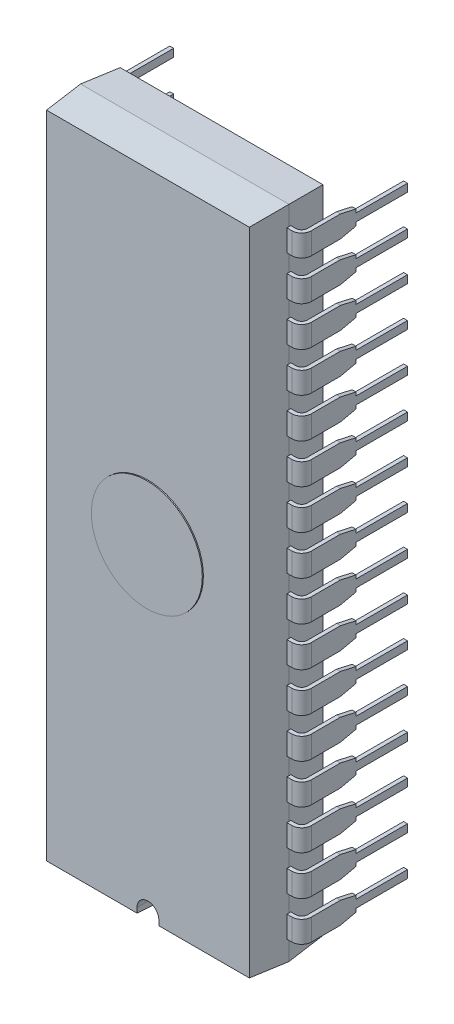
from build123d import *

# Parameters (mm, degrees)
BASIC_SHAPE_DEPTH               = 21.02
SIDE_PROFILE1_DEPTH             = 23.785548051
SIDE_PROFILE1_DEPTH_BACK        = 23.785548051
SIDE_PROFILE2_DEPTH             = 23.785548051
SIDE_PROFILE2_DEPTH_BACK        = 23.785548051
SKETCH6_W                       = 0.25
SKETCH6_H                       = 1.39
PIN_RELIEF_DEPTH                = 26.921132383
REMAINING_PINS_COUNT            = 16
REMAINING_PINS_PITCH            = 2.54
REMAINING_PINS_COPY_1_SKETCH_W  = 0.25
REMAINING_PINS_COPY_1_SKETCH_H  = 1.39
REMAINING_PINS_COPY_2_SKETCH_W  = 0.25
REMAINING_PINS_COPY_2_SKETCH_H  = 1.39
REMAINING_PINS_COPY_3_SKETCH_W  = 0.25
REMAINING_PINS_COPY_3_SKETCH_H  = 1.39
REMAINING_PINS_COPY_4_SKETCH_W  = 0.25
REMAINING_PINS_COPY_4_SKETCH_H  = 1.39
REMAINING_PINS_COPY_5_SKETCH_W  = 0.25
REMAINING_PINS_COPY_5_SKETCH_H  = 1.39
REMAINING_PINS_COPY_6_SKETCH_W  = 0.25
REMAINING_PINS_COPY_6_SKETCH_H  = 1.39
REMAINING_PINS_COPY_7_SKETCH_W  = 0.25
REMAINING_PINS_COPY_7_SKETCH_H  = 1.39
REMAINING_PINS_COPY_8_SKETCH_W  = 0.25
REMAINING_PINS_COPY_8_SKETCH_H  = 1.39
REMAINING_PINS_COPY_9_SKETCH_W  = 0.25
REMAINING_PINS_COPY_9_SKETCH_H  = 1.39
REMAINING_PINS_COPY_10_SKETCH_W = 0.25
REMAINING_PINS_COPY_10_SKETCH_H = 1.39
REMAINING_PINS_COPY_11_SKETCH_W = 0.25
REMAINING_PINS_COPY_11_SKETCH_H = 1.39
REMAINING_PINS_COPY_12_SKETCH_W = 0.25
REMAINING_PINS_COPY_12_SKETCH_H = 1.39
REMAINING_PINS_COPY_13_SKETCH_W = 0.25
REMAINING_PINS_COPY_13_SKETCH_H = 1.39
REMAINING_PINS_COPY_14_SKETCH_W = 0.25
REMAINING_PINS_COPY_14_SKETCH_H = 1.39
REMAINING_PINS_COPY_15_SKETCH_W = 0.25
REMAINING_PINS_COPY_15_SKETCH_H = 1.39
REMAINING_PINS_COPY_16_DEPTH    = 26.921132383
REMAINING_PINS_COPY_17_DEPTH    = 26.921132383
REMAINING_PINS_COPY_18_DEPTH    = 26.921132383
REMAINING_PINS_COPY_19_DEPTH    = 26.921132383
REMAINING_PINS_COPY_20_DEPTH    = 26.921132383
REMAINING_PINS_COPY_21_DEPTH    = 26.921132383
REMAINING_PINS_COPY_22_DEPTH    = 26.921132383
REMAINING_PINS_COPY_23_DEPTH    = 26.921132383
REMAINING_PINS_COPY_24_DEPTH    = 26.921132383
REMAINING_PINS_COPY_25_DEPTH    = 26.921132383
REMAINING_PINS_COPY_26_DEPTH    = 26.921132383
REMAINING_PINS_COPY_27_DEPTH    = 26.921132383
REMAINING_PINS_COPY_28_DEPTH    = 26.921132383
REMAINING_PINS_COPY_29_DEPTH    = 26.921132383
REMAINING_PINS_COPY_30_DEPTH    = 26.921132383
WINDOW_START                    = 5.72
WINDOW_OUTLINE_R                = 3.556
WINDOW_DEPTH                    = 0.07
LOCATION_MARK_DEPTH             = 25.108810091


# Read off the part's stored shape, not the designer's step: Window
with BuildPart() as part:
    # Sketch1 → Basic Shape (new, symmetric)
    with BuildSketch(Plane(origin=(0, 0, 0), x_dir=(1, 0, 0), z_dir=(0, 1, 0))):
        Polygon((-6.5, -5.72), (-6.68, -3.36), (-6.5, -1), (6.5, -1), (6.68, -3.36), (6.5, -5.72), align=None)
    extrude(amount=BASIC_SHAPE_DEPTH, both=True)

    # Sketch2 → Side Profile1 (cut, two sides: drawn at the far end of the back side and taken through both)
    with BuildSketch(Plane(origin=(0, 0, 0), x_dir=(0, 0, -1), z_dir=(1, 0, 0)).offset(-SIDE_PROFILE1_DEPTH_BACK)):
        Polygon((-1, 21.02), (-1, 20.84), (-3.36, 21.02), align=None)
        Polygon((-1, -21.02), (-3.36, -21.02), (-1, -20.84), align=None)
    extrude(amount=SIDE_PROFILE1_DEPTH + SIDE_PROFILE1_DEPTH_BACK, mode=Mode.SUBTRACT)

    # Sketch3 → Side Profile2 (cut, two sides: drawn at the far end of the back side and taken through both)
    with BuildSketch(Plane(origin=(0, 0, 0), x_dir=(0, 0, -1), z_dir=(1, 0, 0)).offset(-SIDE_PROFILE2_DEPTH_BACK)):
        Polygon((-3.36, 21.02), (-5.72, 21.02), (-5.72, 20.84), align=None)
        Polygon((-3.36, -21.02), (-5.72, -21.02), (-5.72, -20.84), align=None)
    extrude(amount=SIDE_PROFILE2_DEPTH + SIDE_PROFILE2_DEPTH_BACK, mode=Mode.SUBTRACT)

    # First Pin: sweep along a path in Sketch5
    with BuildLine(Plane(origin=(0, -19.02, 0), x_dir=(1, 0, 0), z_dir=(0, 1, 0))) as first_pin_path:
        Line((0, -3.36), (6.993, -3.36))
        ThreePointArc((6.993, -3.36), (7.346553391, -3.213553391), (7.493, -2.86))
        Line((7.493, -2.86), (7.493, 3.3))
    # Sketch6 → First Pin (sweep)
    with BuildSketch(Plane(origin=(0, 0, 0), x_dir=(0, 0, -1), z_dir=(1, 0, 0))):
        with Locations((-3.36, -19.02)):
            Rectangle(SKETCH6_W, SKETCH6_H)
    first_pin = sweep(path=first_pin_path.line)

    # Sketch7 → Pin Relief (cut, through all)
    with BuildSketch(Plane.ZY.offset(-7.368)):
        Polygon((-3.3, -19.27), (0, -19.27), (0, -19.4925), (1, -19.715), (-3.3, -19.715), align=None)
        Polygon((-3.3, -18.77), (0, -18.77), (0, -18.5475), (1, -18.325), (-3.3, -18.325), align=None)
    pin_relief = extrude(amount=-PIN_RELIEF_DEPTH, mode=Mode.SUBTRACT)

    # Opp Pin: First Pin, Pin Relief across plane
    add(first_pin.mirror(Plane(origin=(0, 0, 0), x_dir=(0, 0, 1), z_dir=(1, 0, 0))))
    add(pin_relief.mirror(Plane(origin=(0, 0, 0), x_dir=(0, 0, 1), z_dir=(1, 0, 0))), mode=Mode.SUBTRACT)

    # Remaining Pins: First Pin, Pin Relief ×16
    with Locations(*[(0, i * REMAINING_PINS_PITCH, 0) for i in range(1, REMAINING_PINS_COUNT)]):
        add(first_pin)
        add(pin_relief, mode=Mode.SUBTRACT)

    # Remaining Pins copy 1: sweep along a path in Remaining Pins copy 1 path
    with BuildLine(Plane(origin=(0, -16.48, 0), x_dir=(-1, 0, 0), z_dir=(0, 1, 0))) as remaining_pins_copy_1_path:
        Line((0, 3.36), (6.993, 3.36))
        ThreePointArc((6.993, 3.36), (7.346553391, 3.213553391), (7.493, 2.86))
        Line((7.493, 2.86), (7.493, -3.3))
    # Remaining Pins copy 1 sketch → Remaining Pins copy 1 (sweep)
    with BuildSketch(Plane(origin=(0, 2.54, 0), x_dir=(0, 0, -1), z_dir=(-1, 0, 0))):
        with Locations((-3.36, 19.02)):
            Rectangle(REMAINING_PINS_COPY_1_SKETCH_W, REMAINING_PINS_COPY_1_SKETCH_H)
    sweep(path=remaining_pins_copy_1_path.line)

    # Remaining Pins copy 2: sweep along a path in Remaining Pins copy 2 path
    with BuildLine(Plane(origin=(0, -13.94, 0), x_dir=(-1, 0, 0), z_dir=(0, 1, 0))) as remaining_pins_copy_2_path:
        Line((0, 3.36), (6.993, 3.36))
        ThreePointArc((6.993, 3.36), (7.346553391, 3.213553391), (7.493, 2.86))
        Line((7.493, 2.86), (7.493, -3.3))
    # Remaining Pins copy 2 sketch → Remaining Pins copy 2 (sweep)
    with BuildSketch(Plane(origin=(0, 5.08, 0), x_dir=(0, 0, -1), z_dir=(-1, 0, 0))):
        with Locations((-3.36, 19.02)):
            Rectangle(REMAINING_PINS_COPY_2_SKETCH_W, REMAINING_PINS_COPY_2_SKETCH_H)
    sweep(path=remaining_pins_copy_2_path.line)

    # Remaining Pins copy 3: sweep along a path in Remaining Pins copy 3 path
    with BuildLine(Plane(origin=(0, -11.4, 0), x_dir=(-1, 0, 0), z_dir=(0, 1, 0))) as remaining_pins_copy_3_path:
        Line((0, 3.36), (6.993, 3.36))
        ThreePointArc((6.993, 3.36), (7.346553391, 3.213553391), (7.493, 2.86))
        Line((7.493, 2.86), (7.493, -3.3))
    # Remaining Pins copy 3 sketch → Remaining Pins copy 3 (sweep)
    with BuildSketch(Plane(origin=(0, 7.62, 0), x_dir=(0, 0, -1), z_dir=(-1, 0, 0))):
        with Locations((-3.36, 19.02)):
            Rectangle(REMAINING_PINS_COPY_3_SKETCH_W, REMAINING_PINS_COPY_3_SKETCH_H)
    sweep(path=remaining_pins_copy_3_path.line)

    # Remaining Pins copy 4: sweep along a path in Remaining Pins copy 4 path
    with BuildLine(Plane(origin=(0, -8.86, 0), x_dir=(-1, 0, 0), z_dir=(0, 1, 0))) as remaining_pins_copy_4_path:
        Line((0, 3.36), (6.993, 3.36))
        ThreePointArc((6.993, 3.36), (7.346553391, 3.213553391), (7.493, 2.86))
        Line((7.493, 2.86), (7.493, -3.3))
    # Remaining Pins copy 4 sketch → Remaining Pins copy 4 (sweep)
    with BuildSketch(Plane(origin=(0, 10.16, 0), x_dir=(0, 0, -1), z_dir=(-1, 0, 0))):
        with Locations((-3.36, 19.02)):
            Rectangle(REMAINING_PINS_COPY_4_SKETCH_W, REMAINING_PINS_COPY_4_SKETCH_H)
    sweep(path=remaining_pins_copy_4_path.line)

    # Remaining Pins copy 5: sweep along a path in Remaining Pins copy 5 path
    with BuildLine(Plane(origin=(0, -6.32, 0), x_dir=(-1, 0, 0), z_dir=(0, 1, 0))) as remaining_pins_copy_5_path:
        Line((0, 3.36), (6.993, 3.36))
        ThreePointArc((6.993, 3.36), (7.346553391, 3.213553391), (7.493, 2.86))
        Line((7.493, 2.86), (7.493, -3.3))
    # Remaining Pins copy 5 sketch → Remaining Pins copy 5 (sweep)
    with BuildSketch(Plane(origin=(0, 12.7, 0), x_dir=(0, 0, -1), z_dir=(-1, 0, 0))):
        with Locations((-3.36, 19.02)):
            Rectangle(REMAINING_PINS_COPY_5_SKETCH_W, REMAINING_PINS_COPY_5_SKETCH_H)
    sweep(path=remaining_pins_copy_5_path.line)

    # Remaining Pins copy 6: sweep along a path in Remaining Pins copy 6 path
    with BuildLine(Plane(origin=(0, -3.78, 0), x_dir=(-1, 0, 0), z_dir=(0, 1, 0))) as remaining_pins_copy_6_path:
        Line((0, 3.36), (6.993, 3.36))
        ThreePointArc((6.993, 3.36), (7.346553391, 3.213553391), (7.493, 2.86))
        Line((7.493, 2.86), (7.493, -3.3))
    # Remaining Pins copy 6 sketch → Remaining Pins copy 6 (sweep)
    with BuildSketch(Plane(origin=(0, 15.24, 0), x_dir=(0, 0, -1), z_dir=(-1, 0, 0))):
        with Locations((-3.36, 19.02)):
            Rectangle(REMAINING_PINS_COPY_6_SKETCH_W, REMAINING_PINS_COPY_6_SKETCH_H)
    sweep(path=remaining_pins_copy_6_path.line)

    # Remaining Pins copy 7: sweep along a path in Remaining Pins copy 7 path
    with BuildLine(Plane(origin=(0, -1.24, 0), x_dir=(-1, 0, 0), z_dir=(0, 1, 0))) as remaining_pins_copy_7_path:
        Line((0, 3.36), (6.993, 3.36))
        ThreePointArc((6.993, 3.36), (7.346553391, 3.213553391), (7.493, 2.86))
        Line((7.493, 2.86), (7.493, -3.3))
    # Remaining Pins copy 7 sketch → Remaining Pins copy 7 (sweep)
    with BuildSketch(Plane(origin=(0, 17.78, 0), x_dir=(0, 0, -1), z_dir=(-1, 0, 0))):
        with Locations((-3.36, 19.02)):
            Rectangle(REMAINING_PINS_COPY_7_SKETCH_W, REMAINING_PINS_COPY_7_SKETCH_H)
    sweep(path=remaining_pins_copy_7_path.line)

    # Remaining Pins copy 8: sweep along a path in Remaining Pins copy 8 path
    with BuildLine(Plane(origin=(0, 1.3, 0), x_dir=(-1, 0, 0), z_dir=(0, 1, 0))) as remaining_pins_copy_8_path:
        Line((0, 3.36), (6.993, 3.36))
        ThreePointArc((6.993, 3.36), (7.346553391, 3.213553391), (7.493, 2.86))
        Line((7.493, 2.86), (7.493, -3.3))
    # Remaining Pins copy 8 sketch → Remaining Pins copy 8 (sweep)
    with BuildSketch(Plane(origin=(0, 20.32, 0), x_dir=(0, 0, -1), z_dir=(-1, 0, 0))):
        with Locations((-3.36, 19.02)):
            Rectangle(REMAINING_PINS_COPY_8_SKETCH_W, REMAINING_PINS_COPY_8_SKETCH_H)
    sweep(path=remaining_pins_copy_8_path.line)

    # Remaining Pins copy 9: sweep along a path in Remaining Pins copy 9 path
    with BuildLine(Plane(origin=(0, 3.84, 0), x_dir=(-1, 0, 0), z_dir=(0, 1, 0))) as remaining_pins_copy_9_path:
        Line((0, 3.36), (6.993, 3.36))
        ThreePointArc((6.993, 3.36), (7.346553391, 3.213553391), (7.493, 2.86))
        Line((7.493, 2.86), (7.493, -3.3))
    # Remaining Pins copy 9 sketch → Remaining Pins copy 9 (sweep)
    with BuildSketch(Plane(origin=(0, 22.86, 0), x_dir=(0, 0, -1), z_dir=(-1, 0, 0))):
        with Locations((-3.36, 19.02)):
            Rectangle(REMAINING_PINS_COPY_9_SKETCH_W, REMAINING_PINS_COPY_9_SKETCH_H)
    sweep(path=remaining_pins_copy_9_path.line)

    # Remaining Pins copy 10: sweep along a path in Remaining Pins copy 10 path
    with BuildLine(Plane(origin=(0, 6.38, 0), x_dir=(-1, 0, 0), z_dir=(0, 1, 0))) as remaining_pins_copy_10_path:
        Line((0, 3.36), (6.993, 3.36))
        ThreePointArc((6.993, 3.36), (7.346553391, 3.213553391), (7.493, 2.86))
        Line((7.493, 2.86), (7.493, -3.3))
    # Remaining Pins copy 10 sketch → Remaining Pins copy 10 (sweep)
    with BuildSketch(Plane(origin=(0, 25.4, 0), x_dir=(0, 0, -1), z_dir=(-1, 0, 0))):
        with Locations((-3.36, 19.02)):
            Rectangle(REMAINING_PINS_COPY_10_SKETCH_W, REMAINING_PINS_COPY_10_SKETCH_H)
    sweep(path=remaining_pins_copy_10_path.line)

    # Remaining Pins copy 11: sweep along a path in Remaining Pins copy 11 path
    with BuildLine(Plane(origin=(0, 8.92, 0), x_dir=(-1, 0, 0), z_dir=(0, 1, 0))) as remaining_pins_copy_11_path:
        Line((0, 3.36), (6.993, 3.36))
        ThreePointArc((6.993, 3.36), (7.346553391, 3.213553391), (7.493, 2.86))
        Line((7.493, 2.86), (7.493, -3.3))
    # Remaining Pins copy 11 sketch → Remaining Pins copy 11 (sweep)
    with BuildSketch(Plane(origin=(0, 27.94, 0), x_dir=(0, 0, -1), z_dir=(-1, 0, 0))):
        with Locations((-3.36, 19.02)):
            Rectangle(REMAINING_PINS_COPY_11_SKETCH_W, REMAINING_PINS_COPY_11_SKETCH_H)
    sweep(path=remaining_pins_copy_11_path.line)

    # Remaining Pins copy 12: sweep along a path in Remaining Pins copy 12 path
    with BuildLine(Plane(origin=(0, 11.46, 0), x_dir=(-1, 0, 0), z_dir=(0, 1, 0))) as remaining_pins_copy_12_path:
        Line((0, 3.36), (6.993, 3.36))
        ThreePointArc((6.993, 3.36), (7.346553391, 3.213553391), (7.493, 2.86))
        Line((7.493, 2.86), (7.493, -3.3))
    # Remaining Pins copy 12 sketch → Remaining Pins copy 12 (sweep)
    with BuildSketch(Plane(origin=(0, 30.48, 0), x_dir=(0, 0, -1), z_dir=(-1, 0, 0))):
        with Locations((-3.36, 19.02)):
            Rectangle(REMAINING_PINS_COPY_12_SKETCH_W, REMAINING_PINS_COPY_12_SKETCH_H)
    sweep(path=remaining_pins_copy_12_path.line)

    # Remaining Pins copy 13: sweep along a path in Remaining Pins copy 13 path
    with BuildLine(Plane(origin=(0, 14, 0), x_dir=(-1, 0, 0), z_dir=(0, 1, 0))) as remaining_pins_copy_13_path:
        Line((0, 3.36), (6.993, 3.36))
        ThreePointArc((6.993, 3.36), (7.346553391, 3.213553391), (7.493, 2.86))
        Line((7.493, 2.86), (7.493, -3.3))
    # Remaining Pins copy 13 sketch → Remaining Pins copy 13 (sweep)
    with BuildSketch(Plane(origin=(0, 33.02, 0), x_dir=(0, 0, -1), z_dir=(-1, 0, 0))):
        with Locations((-3.36, 19.02)):
            Rectangle(REMAINING_PINS_COPY_13_SKETCH_W, REMAINING_PINS_COPY_13_SKETCH_H)
    sweep(path=remaining_pins_copy_13_path.line)

    # Remaining Pins copy 14: sweep along a path in Remaining Pins copy 14 path
    with BuildLine(Plane(origin=(0, 16.54, 0), x_dir=(-1, 0, 0), z_dir=(0, 1, 0))) as remaining_pins_copy_14_path:
        Line((0, 3.36), (6.993, 3.36))
        ThreePointArc((6.993, 3.36), (7.346553391, 3.213553391), (7.493, 2.86))
        Line((7.493, 2.86), (7.493, -3.3))
    # Remaining Pins copy 14 sketch → Remaining Pins copy 14 (sweep)
    with BuildSketch(Plane(origin=(0, 35.56, 0), x_dir=(0, 0, -1), z_dir=(-1, 0, 0))):
        with Locations((-3.36, 19.02)):
            Rectangle(REMAINING_PINS_COPY_14_SKETCH_W, REMAINING_PINS_COPY_14_SKETCH_H)
    sweep(path=remaining_pins_copy_14_path.line)

    # Remaining Pins copy 15: sweep along a path in Remaining Pins copy 15 path
    with BuildLine(Plane(origin=(0, 19.08, 0), x_dir=(-1, 0, 0), z_dir=(0, 1, 0))) as remaining_pins_copy_15_path:
        Line((0, 3.36), (6.993, 3.36))
        ThreePointArc((6.993, 3.36), (7.346553391, 3.213553391), (7.493, 2.86))
        Line((7.493, 2.86), (7.493, -3.3))
    # Remaining Pins copy 15 sketch → Remaining Pins copy 15 (sweep)
    with BuildSketch(Plane(origin=(0, 38.1, 0), x_dir=(0, 0, -1), z_dir=(-1, 0, 0))):
        with Locations((-3.36, 19.02)):
            Rectangle(REMAINING_PINS_COPY_15_SKETCH_W, REMAINING_PINS_COPY_15_SKETCH_H)
    sweep(path=remaining_pins_copy_15_path.line)

    # Remaining Pins copy 16 sketch → Remaining Pins copy 16 (cut, through all)
    with BuildSketch(Plane(origin=(-7.368, 2.54, 0), x_dir=(0, 0, 1), z_dir=(1, 0, 0))):
        Polygon((-3.3, 19.27), (0, 19.27), (0, 19.4925), (1, 19.715), (-3.3, 19.715), align=None)
        Polygon((-3.3, 18.77), (0, 18.77), (0, 18.5475), (1, 18.325), (-3.3, 18.325), align=None)
    extrude(amount=-REMAINING_PINS_COPY_16_DEPTH, mode=Mode.SUBTRACT)

    # Remaining Pins copy 17 sketch → Remaining Pins copy 17 (cut, through all)
    with BuildSketch(Plane(origin=(-7.368, 5.08, 0), x_dir=(0, 0, 1), z_dir=(1, 0, 0))):
        Polygon((-3.3, 19.27), (0, 19.27), (0, 19.4925), (1, 19.715), (-3.3, 19.715), align=None)
        Polygon((-3.3, 18.77), (0, 18.77), (0, 18.5475), (1, 18.325), (-3.3, 18.325), align=None)
    extrude(amount=-REMAINING_PINS_COPY_17_DEPTH, mode=Mode.SUBTRACT)

    # Remaining Pins copy 18 sketch → Remaining Pins copy 18 (cut, through all)
    with BuildSketch(Plane(origin=(-7.368, 7.62, 0), x_dir=(0, 0, 1), z_dir=(1, 0, 0))):
        Polygon((-3.3, 19.27), (0, 19.27), (0, 19.4925), (1, 19.715), (-3.3, 19.715), align=None)
        Polygon((-3.3, 18.77), (0, 18.77), (0, 18.5475), (1, 18.325), (-3.3, 18.325), align=None)
    extrude(amount=-REMAINING_PINS_COPY_18_DEPTH, mode=Mode.SUBTRACT)

    # Remaining Pins copy 19 sketch → Remaining Pins copy 19 (cut, through all)
    with BuildSketch(Plane(origin=(-7.368, 10.16, 0), x_dir=(0, 0, 1), z_dir=(1, 0, 0))):
        Polygon((-3.3, 19.27), (0, 19.27), (0, 19.4925), (1, 19.715), (-3.3, 19.715), align=None)
        Polygon((-3.3, 18.77), (0, 18.77), (0, 18.5475), (1, 18.325), (-3.3, 18.325), align=None)
    extrude(amount=-REMAINING_PINS_COPY_19_DEPTH, mode=Mode.SUBTRACT)

    # Remaining Pins copy 20 sketch → Remaining Pins copy 20 (cut, through all)
    with BuildSketch(Plane(origin=(-7.368, 12.7, 0), x_dir=(0, 0, 1), z_dir=(1, 0, 0))):
        Polygon((-3.3, 19.27), (0, 19.27), (0, 19.4925), (1, 19.715), (-3.3, 19.715), align=None)
        Polygon((-3.3, 18.77), (0, 18.77), (0, 18.5475), (1, 18.325), (-3.3, 18.325), align=None)
    extrude(amount=-REMAINING_PINS_COPY_20_DEPTH, mode=Mode.SUBTRACT)

    # Remaining Pins copy 21 sketch → Remaining Pins copy 21 (cut, through all)
    with BuildSketch(Plane(origin=(-7.368, 15.24, 0), x_dir=(0, 0, 1), z_dir=(1, 0, 0))):
        Polygon((-3.3, 19.27), (0, 19.27), (0, 19.4925), (1, 19.715), (-3.3, 19.715), align=None)
        Polygon((-3.3, 18.77), (0, 18.77), (0, 18.5475), (1, 18.325), (-3.3, 18.325), align=None)
    extrude(amount=-REMAINING_PINS_COPY_21_DEPTH, mode=Mode.SUBTRACT)

    # Remaining Pins copy 22 sketch → Remaining Pins copy 22 (cut, through all)
    with BuildSketch(Plane(origin=(-7.368, 17.78, 0), x_dir=(0, 0, 1), z_dir=(1, 0, 0))):
        Polygon((-3.3, 19.27), (0, 19.27), (0, 19.4925), (1, 19.715), (-3.3, 19.715), align=None)
        Polygon((-3.3, 18.77), (0, 18.77), (0, 18.5475), (1, 18.325), (-3.3, 18.325), align=None)
    extrude(amount=-REMAINING_PINS_COPY_22_DEPTH, mode=Mode.SUBTRACT)

    # Remaining Pins copy 23 sketch → Remaining Pins copy 23 (cut, through all)
    with BuildSketch(Plane(origin=(-7.368, 20.32, 0), x_dir=(0, 0, 1), z_dir=(1, 0, 0))):
        Polygon((-3.3, 19.27), (0, 19.27), (0, 19.4925), (1, 19.715), (-3.3, 19.715), align=None)
        Polygon((-3.3, 18.77), (0, 18.77), (0, 18.5475), (1, 18.325), (-3.3, 18.325), align=None)
    extrude(amount=-REMAINING_PINS_COPY_23_DEPTH, mode=Mode.SUBTRACT)

    # Remaining Pins copy 24 sketch → Remaining Pins copy 24 (cut, through all)
    with BuildSketch(Plane(origin=(-7.368, 22.86, 0), x_dir=(0, 0, 1), z_dir=(1, 0, 0))):
        Polygon((-3.3, 19.27), (0, 19.27), (0, 19.4925), (1, 19.715), (-3.3, 19.715), align=None)
        Polygon((-3.3, 18.77), (0, 18.77), (0, 18.5475), (1, 18.325), (-3.3, 18.325), align=None)
    extrude(amount=-REMAINING_PINS_COPY_24_DEPTH, mode=Mode.SUBTRACT)

    # Remaining Pins copy 25 sketch → Remaining Pins copy 25 (cut, through all)
    with BuildSketch(Plane(origin=(-7.368, 25.4, 0), x_dir=(0, 0, 1), z_dir=(1, 0, 0))):
        Polygon((-3.3, 19.27), (0, 19.27), (0, 19.4925), (1, 19.715), (-3.3, 19.715), align=None)
        Polygon((-3.3, 18.77), (0, 18.77), (0, 18.5475), (1, 18.325), (-3.3, 18.325), align=None)
    extrude(amount=-REMAINING_PINS_COPY_25_DEPTH, mode=Mode.SUBTRACT)

    # Remaining Pins copy 26 sketch → Remaining Pins copy 26 (cut, through all)
    with BuildSketch(Plane(origin=(-7.368, 27.94, 0), x_dir=(0, 0, 1), z_dir=(1, 0, 0))):
        Polygon((-3.3, 19.27), (0, 19.27), (0, 19.4925), (1, 19.715), (-3.3, 19.715), align=None)
        Polygon((-3.3, 18.77), (0, 18.77), (0, 18.5475), (1, 18.325), (-3.3, 18.325), align=None)
    extrude(amount=-REMAINING_PINS_COPY_26_DEPTH, mode=Mode.SUBTRACT)

    # Remaining Pins copy 27 sketch → Remaining Pins copy 27 (cut, through all)
    with BuildSketch(Plane(origin=(-7.368, 30.48, 0), x_dir=(0, 0, 1), z_dir=(1, 0, 0))):
        Polygon((-3.3, 19.27), (0, 19.27), (0, 19.4925), (1, 19.715), (-3.3, 19.715), align=None)
        Polygon((-3.3, 18.77), (0, 18.77), (0, 18.5475), (1, 18.325), (-3.3, 18.325), align=None)
    extrude(amount=-REMAINING_PINS_COPY_27_DEPTH, mode=Mode.SUBTRACT)

    # Remaining Pins copy 28 sketch → Remaining Pins copy 28 (cut, through all)
    with BuildSketch(Plane(origin=(-7.368, 33.02, 0), x_dir=(0, 0, 1), z_dir=(1, 0, 0))):
        Polygon((-3.3, 19.27), (0, 19.27), (0, 19.4925), (1, 19.715), (-3.3, 19.715), align=None)
        Polygon((-3.3, 18.77), (0, 18.77), (0, 18.5475), (1, 18.325), (-3.3, 18.325), align=None)
    extrude(amount=-REMAINING_PINS_COPY_28_DEPTH, mode=Mode.SUBTRACT)

    # Remaining Pins copy 29 sketch → Remaining Pins copy 29 (cut, through all)
    with BuildSketch(Plane(origin=(-7.368, 35.56, 0), x_dir=(0, 0, 1), z_dir=(1, 0, 0))):
        Polygon((-3.3, 19.27), (0, 19.27), (0, 19.4925), (1, 19.715), (-3.3, 19.715), align=None)
        Polygon((-3.3, 18.77), (0, 18.77), (0, 18.5475), (1, 18.325), (-3.3, 18.325), align=None)
    extrude(amount=-REMAINING_PINS_COPY_29_DEPTH, mode=Mode.SUBTRACT)

    # Remaining Pins copy 30 sketch → Remaining Pins copy 30 (cut, through all)
    with BuildSketch(Plane(origin=(-7.368, 38.1, 0), x_dir=(0, 0, 1), z_dir=(1, 0, 0))):
        Polygon((-3.3, 19.27), (0, 19.27), (0, 19.4925), (1, 19.715), (-3.3, 19.715), align=None)
        Polygon((-3.3, 18.77), (0, 18.77), (0, 18.5475), (1, 18.325), (-3.3, 18.325), align=None)
    extrude(amount=-REMAINING_PINS_COPY_30_DEPTH, mode=Mode.SUBTRACT)

    # Window outline → Window (add)
    with BuildSketch(Plane.XY.offset(WINDOW_START)):
        Circle(WINDOW_OUTLINE_R)
    extrude(amount=WINDOW_DEPTH)

    # Sketch4 → Location Mark (cut, through all)
    with BuildSketch(Plane.XY.offset(5.72)):
        with BuildLine():
            Line((-0.7, -21.02), (-0.7, -20.52))
            ThreePointArc((-0.7, -20.52), (0, -19.82), (0.7, -20.52))
            Line((0.7, -20.52), (0.7, -21.02))
            Line((0.7, -21.02), (-0.7, -21.02))
        make_face()
    extrude(amount=-LOCATION_MARK_DEPTH, mode=Mode.SUBTRACT)


solid = part.part
